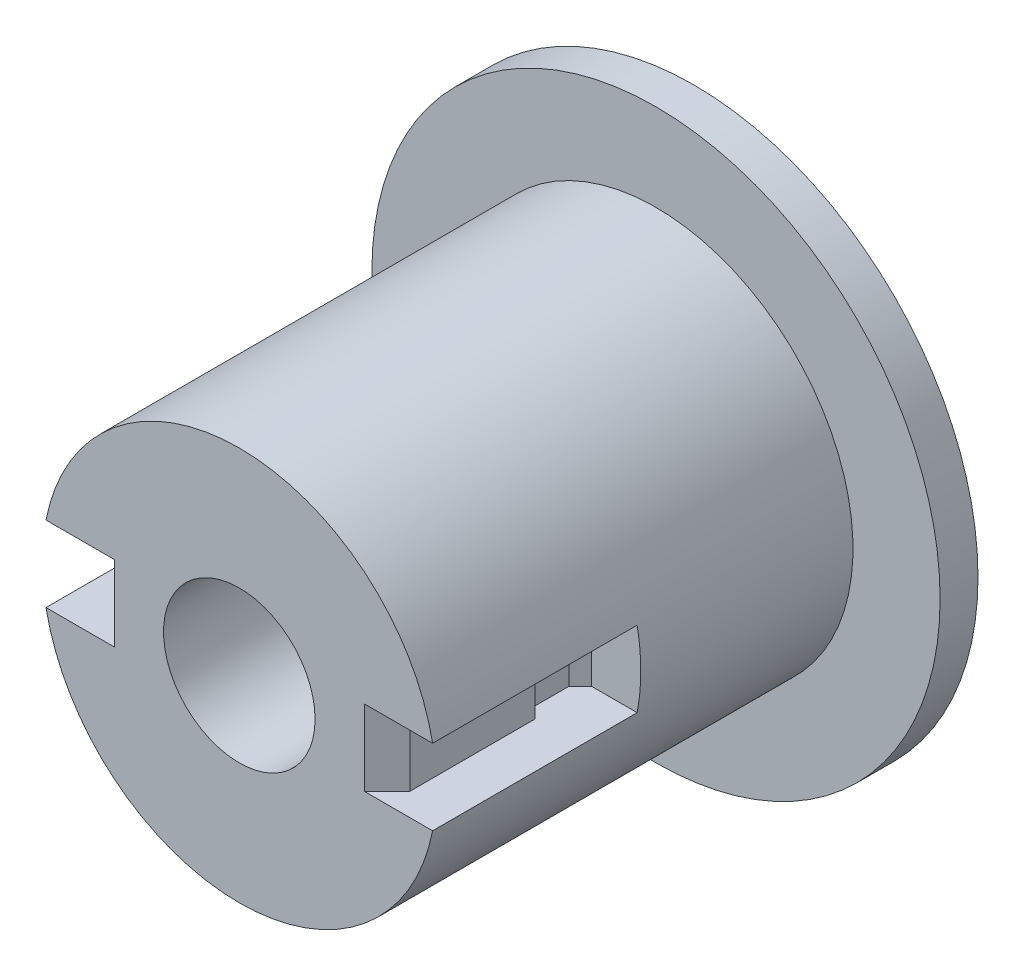
from build123d import *

# Parameters (mm, degrees)
AXLE_BASE_SKETCH_R        = 26
AXLE_DEPTH                = 55
GUARD_BASE_SKETCH_R       = 37.5
GUARD_BASE_DEPTH          = 5
INNER_AXLE_BASE_SKETCH_R  = 10
INNER_AXLE_HOLE_DEPTH     = 81.07808689
COUPLING_TOOTH_ROOM_DEPTH = 5


with BuildPart() as part:
    # Axle base sketch → Axle (new body)
    with BuildSketch(Plane.XY):
        Circle(AXLE_BASE_SKETCH_R)
    extrude(amount=AXLE_DEPTH)

    # Guard base sketch → Guard base (add)
    with BuildSketch(Plane(origin=(0, 0, 0), x_dir=(-1, 0, 0), z_dir=(0, 0, -1))):
        Circle(GUARD_BASE_SKETCH_R)
    extrude(amount=GUARD_BASE_DEPTH)

    # Inner axle base sketch → Inner axle hole (cut, through all)
    with BuildSketch(Plane.XY.offset(55)):
        Circle(INNER_AXLE_BASE_SKETCH_R)
    extrude(amount=-INNER_AXLE_HOLE_DEPTH, mode=Mode.SUBTRACT)

    # Coupling tooth base sketch → Coupling tooth room (cut, symmetric)
    with BuildSketch(Plane(origin=(0, 0, 0), x_dir=(1, 0, 0), z_dir=(0, 1, 0))):
        Polygon((19.5, -52), (16.5, -55), (26, -55), (26, -28), (19.5, -28), (18, -29.5), (18, -34), (19.5, -35.5), align=None)
    coupling_tooth_room = extrude(amount=COUPLING_TOOTH_ROOM_DEPTH, both=True, mode=Mode.SUBTRACT)

    # Coupling teeth: Coupling tooth room across plane
    add(coupling_tooth_room.mirror(Plane(origin=(0, 0, 0), x_dir=(0, 0, 1), z_dir=(1, 0, 0))), mode=Mode.SUBTRACT)


solid = part.part
